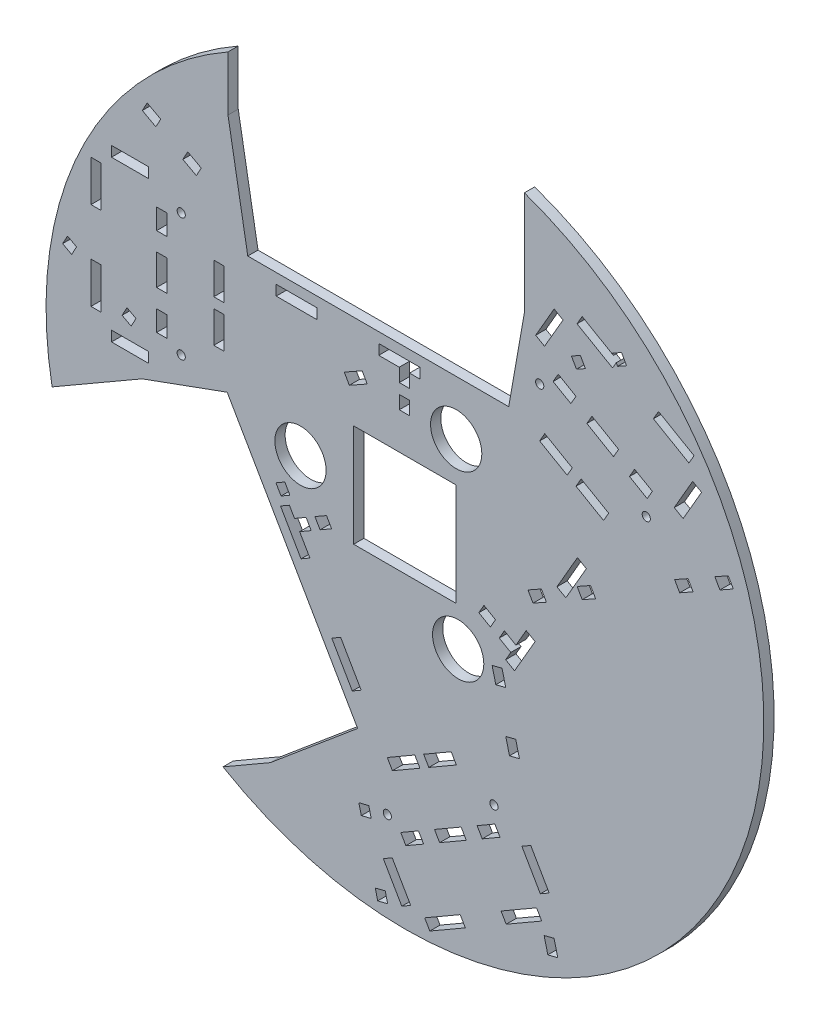
from build123d import *

# Parameters (mm, degrees)
ESQUISSE1_R                   = 175
BOSS_EXTRU_1_DEPTH            = 5
ESQUISSE2_W                   = 18
ESQUISSE2_H                   = 5
ESQUISSE2_W_2                 = 5
ESQUISSE2_H_2                 = 20
ESQUISSE2_H_3                 = 10
ESQUISSE2_H_4                 = 15
ESQUISSE2_H_5                 = 15.5
ESQUISSE2_W_3                 = 20
ESQUISSE2_H_6                 = 6.5
ENL_V_MAT_EXTRU_1_DEPTH       = 5
ESQUISSE6_R                   = 12.5
ESQUISSE6_W                   = 50
ESQUISSE6_H                   = 50
ENL_V_MAT_EXTRU_6_DEPTH       = 5
TROUS_DE_CENTRAGE_4_0MM1_D    = 4
HOLES_CATCHERS_OF_GLASS_DEPTH = 10
HOLES_BOARDS_SERVO_DEPTH      = 10


with BuildPart() as part:
    # Esquisse1 → Boss.-Extru.1 (new body)
    with BuildSketch(Plane.XY):
        with Locations((148.080426897, -12.110171348)):
            Circle(ESQUISSE1_R)
    extrude(amount=BOSS_EXTRU_1_DEPTH)

    # Esquisse2 → Enlèv. mat.-Extru.1 (cut)
    with BuildSketch(Plane.XY.offset(5)):
        Polygon((135.311788567, 53.777441362), (135.311788567, 48.777441362), (145.311788567, 48.777441362), (145.311788567, 42.277441362), (150.311788567, 42.277441362), (150.311788567, 48.777441362), (155.311788567, 48.777441362), (155.311788567, 53.777441362), align=None)
        with Locations((14, 69.777441362)):
            Rectangle(ESQUISSE2_W, ESQUISSE2_H)
        with Locations((-2.5, 52.277441362)):
            Rectangle(ESQUISSE2_W_2, ESQUISSE2_H_2)
        with Locations((-2.5, 9.277441362)):
            Rectangle(ESQUISSE2_W_2, ESQUISSE2_H_2)
        with Locations((14, -8.222558638)):
            Rectangle(ESQUISSE2_W, ESQUISSE2_H)
        with Locations((29.5, 9.277441362)):
            Rectangle(ESQUISSE2_W_2, ESQUISSE2_H_3)
        with Locations((29.5, 30.777441362)):
            Rectangle(ESQUISSE2_W_2, ESQUISSE2_H_4)
        with Locations((29.5, 52.277441362)):
            Rectangle(ESQUISSE2_W_2, ESQUISSE2_H_3)
        with Locations((57.36, 41.027441362)):
            Rectangle(ESQUISSE2_W_2, ESQUISSE2_H_5)
        with Locations((57.36, 20.527441362)):
            Rectangle(ESQUISSE2_W_2, ESQUISSE2_H_5)
        with Locations((95.311788567, 51.277441362)):
            Rectangle(ESQUISSE2_W_3, ESQUISSE2_H)
        with Locations((147.811788567, 34.027441362)):
            Rectangle(ESQUISSE2_W_2, ESQUISSE2_H_6)
        Polygon((292.702456717, 69.607306773), (283.702456717, 54.018849505), (279.372329698, 56.518849505), (288.372329698, 72.107306773), align=None)
        Polygon((289.042202679, 83.267560811), (286.542202679, 78.937433792), (269.221694603, 88.937433792), (271.721694603, 93.267560811), align=None)
        Polygon((251.803110316, 104.767560811), (249.303110316, 100.437433792), (231.982602241, 110.437433792), (234.482602241, 114.767560811), align=None)
        Polygon((225.152475222, 108.607306773), (216.152475222, 93.018849505), (211.822348203, 95.518849505), (220.822348203, 111.107306773), align=None)
        Polygon((231.472983297, 79.55474789), (228.972983297, 75.224620871), (220.31272926, 80.224620871), (222.81272926, 84.55474789), align=None)
        Polygon((252.257592988, 67.55474789), (249.757592988, 63.224620871), (236.767211932, 70.724620871), (239.267211932, 75.05474789), align=None)
        Polygon((268.71207566, 58.05474789), (266.21207566, 53.724620871), (257.551821622, 58.724620871), (260.051821622, 63.05474789), align=None)
        Polygon((247.420859728, 38.17728014), (244.920859728, 33.847153121), (231.497465969, 41.597153121), (233.997465969, 45.92728014), align=None)
        Polygon((229.66733895, 48.42728014), (227.16733895, 44.097153121), (213.743945192, 51.847153121), (216.243945192, 56.17728014), align=None)
        Polygon((211.525092463, -33.996012539), (207.194965444, -31.496012539), (202.194965444, -40.156266577), (196.56580032, -36.906266577), (194.06580032, -41.236393596), (199.694965444, -44.486393596), (197.194965444, -48.816520615), (201.525092463, -51.316520615), align=None)
        Polygon((236.525092463, 9.30525765), (226.525092463, -8.015250425), (222.194965444, -5.515250425), (232.194965444, 11.80525765), align=None)
        Polygon((192.235673301, -34.406266577), (189.735673301, -38.736393596), (184.106508176, -35.486393596), (186.606508176, -31.156266577), align=None)
        Polygon((146.538823973, -178.215262181), (137.538823973, -162.626804912), (141.868950992, -160.126804912), (150.868950992, -175.715262181), align=None)
        Polygon((160.199078011, -181.875516218), (157.699078011, -177.545389199), (175.019586086, -167.545389199), (177.519586086, -171.875516218), align=None)
        Polygon((197.438170373, -160.375516218), (194.938170373, -156.045389199), (212.258678449, -146.045389199), (214.758678449, -150.375516218), align=None)
        Polygon((214.088805468, -139.215262181), (205.088805468, -123.626804912), (209.418932487, -121.126804912), (218.418932487, -136.715262181), align=None)
        Polygon((185.768297392, -130.162703297), (183.268297392, -125.832576278), (191.92855143, -120.832576278), (194.42855143, -125.162703297), align=None)
        Polygon((164.983687701, -142.162703297), (162.483687701, -137.832576278), (175.474068758, -130.332576278), (177.974068758, -134.662703297), align=None)
        Polygon((148.52920503, -151.662703297), (146.02920503, -147.332576278), (154.689459067, -142.332576278), (157.189459067, -146.662703297), align=None)
        Polygon((141.960420962, -123.285235548), (139.460420962, -118.955108529), (152.88381472, -111.205108529), (155.38381472, -115.535235548), align=None)
        Polygon((159.713941739, -113.035235548), (157.213941739, -108.705108529), (170.637335498, -100.955108529), (173.137335498, -105.285235548), align=None)
        Polygon((97.404399659, -56.111942869), (101.734526678, -53.611942869), (96.734526678, -44.951688831), (102.363691803, -41.701688831), (99.863691803, -37.371561812), (94.234526678, -40.621561812), (91.734526678, -36.291434793), (87.404399659, -38.791434793), align=None)
        Polygon((122.404399659, -99.413213058), (112.404399659, -82.092704982), (116.734526678, -79.592704982), (126.734526678, -96.913213058), align=None)
        Polygon((106.693818822, -39.201688831), (104.193818822, -34.871561812), (109.822983946, -31.621561812), (112.322983946, -35.951688831), align=None)
    extrude(amount=-ENL_V_MAT_EXTRU_1_DEPTH, mode=Mode.SUBTRACT)

    # Esquisse6 → Enlèv. mat.-Extru.6 (cut)
    with BuildSketch(Plane.XY.offset(5)):
        with Locations((173.06, 32.277441362)):
            Circle(ESQUISSE6_R)
        with Locations((174.031440566, -55.936922587)):
            Circle(ESQUISSE6_R)
        with Locations((97.149840124, -12.67103282)):
            Circle(ESQUISSE6_R)
        Polygon((206.321253746, 102.221853729), (206.321253746, 185.563712918), (61.797190042, 185.563712918), (61.797190042, 113.486217733), (71.443823398, 58.777441362), (198.660831685, 58.777441362), align=None)
        with Locations((148.080426897, -12.110171348)):
            Rectangle(ESQUISSE6_W, ESQUISSE6_H)
        Polygon((19.945575289, -18.838148298), (-52.230591968, -60.509077893), (20.031439884, -185.670588519), (82.452381756, -149.631840926), (125.008255225, -113.923223194), (61.399751081, -3.750062223), align=None)
    extrude(amount=-ENL_V_MAT_EXTRU_6_DEPTH, mode=Mode.SUBTRACT)

    # Trous de centrage Ø4.0mm1 (through all)
    with Locations(Plane(origin=(148.080426897, -12.110171348, -78), x_dir=(1, 0, 0), z_dir=(0, 0, -1))):
        with Locations((65.70121345, -88.022614393), (117.662737677, -58.022614393), (-109.080426897, -72.887612711), (-109.080426897, -12.887612711), (-8.58231078, 130.910227103), (43.379213447, 100.910227103)):
            Hole(TROUS_DE_CENTRAGE_4_0MM1_D / 2)

    # Esquisse9 → Holes catchers of glass (cut)
    with BuildSketch(Plane.XY.offset(5)):
        Polygon((301.647255965, 32.874727734), (299.200467122, 37.235143352), (305.741090548, 40.905326617), (308.187879391, 36.544910999), align=None)
        Polygon((282.025385687, 21.864177939), (279.578596844, 26.224593557), (286.11922027, 29.894776822), (288.566009113, 25.534361204), align=None)
        Polygon((241.037478884, -1.135637188), (238.590690041, 3.22477843), (232.050066614, -0.445404835), (234.496855458, -4.805820453), align=None)
        Polygon((214.608404145, -10.232560209), (217.055192988, -14.592975826), (210.514569562, -18.263159091), (208.067780719, -13.902743474), align=None)
        Polygon((256.127471573, 104.799683271), (251.767055956, 102.352894427), (249.320267112, 106.713310045), (253.68068273, 109.160098888), align=None)
        Polygon((236.069559733, 93.544454591), (231.709144116, 91.097665748), (229.262355272, 95.458081365), (233.62277089, 97.904870209), align=None)
        Polygon((129.675418669, 33.842806814), (120.954587435, 28.949229127), (118.507798591, 33.309644745), (127.228629826, 38.203222431), align=None)
        Polygon((-16.43844555, 23.279140051), (-12.045948181, 20.890423478), (-14.434664754, 16.49792611), (-18.827162123, 18.886642683), align=None)
        Polygon((12.552037084, 7.51361067), (16.944534453, 5.124894098), (14.55581788, 0.732396729), (10.163320511, 3.121113302), align=None)
        Polygon((22.412737241, 98.907081949), (29.001483294, 95.32400709), (26.612766722, 90.931509721), (20.024020668, 94.514584581), align=None)
        Polygon((42.178975401, 88.157857372), (48.767721454, 84.574782512), (46.379004881, 80.182285143), (39.790258828, 83.765360003), align=None)
        Polygon((126.799616111, -149.834276272), (125.585690653, -144.983875775), (130.43609115, -143.769950316), (131.650016608, -148.620350813), align=None)
        Polygon((134.811524138, -181.846919552), (133.597598679, -176.996519055), (138.447999176, -175.782593596), (139.661924635, -180.632994093), align=None)
        Polygon((190.561972498, -54.501375823), (195.412372995, -53.287450364), (197.233261183, -60.56305111), (192.382860686, -61.776976568), align=None)
        Polygon((202.088963017, -79.964653097), (197.23856252, -81.178578556), (199.059450708, -88.454179302), (203.909851205, -87.240253843), align=None)
        Polygon((222.604303267, -161.936421496), (217.75390277, -163.150346955), (215.933014582, -155.874746209), (220.783415079, -154.660820751), align=None)
    extrude(amount=-HOLES_CATCHERS_OF_GLASS_DEPTH, mode=Mode.SUBTRACT)

    # Esquisse10 → Holes boards servo (cut)
    with BuildSketch(Plane.XY.offset(5)):
        Polygon((89.496120404, -27.614401399), (91.996120404, -31.944528418), (87.66720686, -34.443827818), (85.16720686, -30.113700799), align=None)
    extrude(amount=-HOLES_BOARDS_SERVO_DEPTH, mode=Mode.SUBTRACT)


solid = part.part
